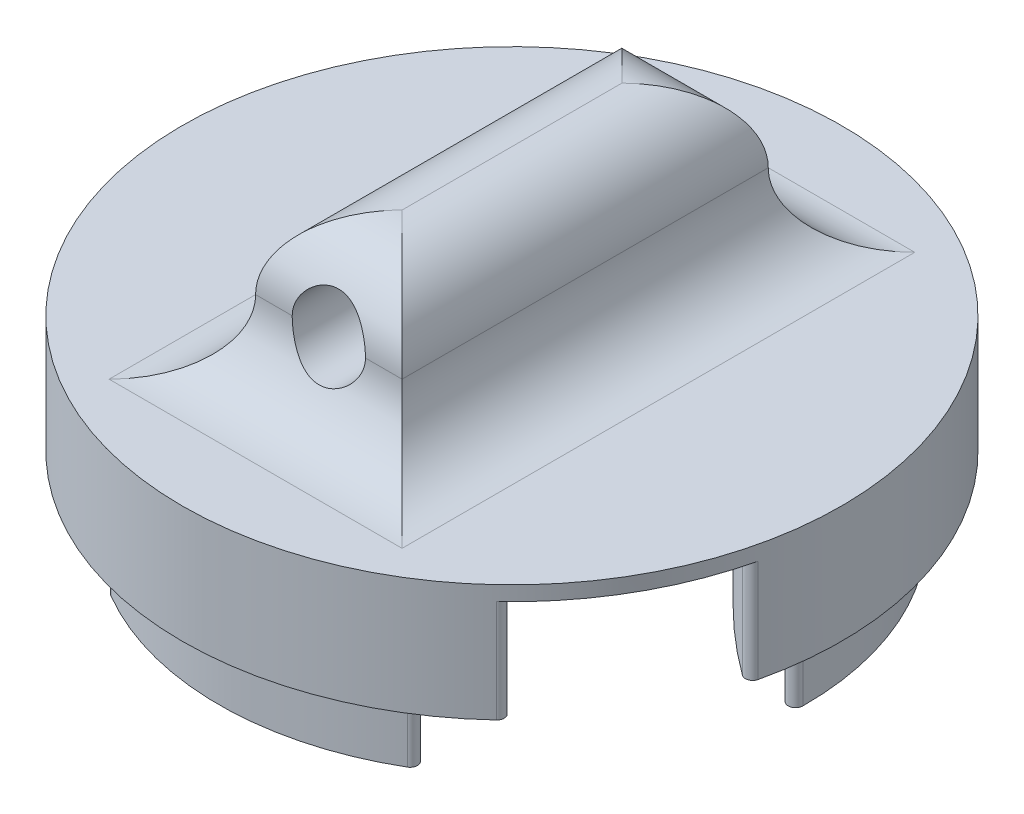
from build123d import *

# Parameters (mm, degrees)
SKETCH1_R                = 37.5
BOSS_EXTRUDE1_DEPTH      = 14
CUT_EXTRUDE2_START       = -14
CUT_EXTRUDE2_DEPTH       = 14
SKETCH4_R                = 45
SKETCH4_R_2              = 37.5
BOSS_EXTRUDE2_DEPTH      = 14
SKETCH6_R                = 45
BOSS_EXTRUDE3_DEPTH      = 2
SKETCH7_R                = 1.75
CUT_EXTRUDE3_DEPTH       = 66.620118866
CIRPATTERN2_COUNT        = 3
BOSS_EXTRUDE4_DEPTH      = 10
FILLET1_R                = 1
CIRPATTERN3_COUNT        = 3
FILLET1_OF_CIRPATTERN3_R = 1
CUT_EXTRUDE4_DEPTH       = 69.01470446
FILLET2_R                = 1
SKETCH15_R               = 45
BOSS_EXTRUDE5_DEPTH      = 2
SKETCH16_W               = 20
SKETCH16_H               = 50
BOSS_EXTRUDE6_DEPTH      = 20
SKETCH17_R               = 5
CUT_EXTRUDE5_DEPTH       = 91.669730467
FILLET3_R                = 10


# Read off the part's stored shape, not the designer's step: Cut-Extrude2
with BuildPart() as part:
    # Sketch1 → Boss-Extrude1 (new body)
    with BuildSketch(Plane(origin=(0, 0, 0), x_dir=(1, 0, 0), z_dir=(0, 1, 0))):
        with Locations(Location((0, 0, 0), (0, 0, 270))):
            Circle(SKETCH1_R)
    extrude(amount=BOSS_EXTRUDE1_DEPTH)

    # Cut-Extrude2 outline → Cut-Extrude2 (cut)
    with BuildSketch(Plane(origin=(0, 14, 0), x_dir=(1, 0, 0), z_dir=(0, 1, 0)).offset(CUT_EXTRUDE2_START)):
        with BuildLine():
            ThreePointArc((-24.104535363, -28.726666617), (0, -24.760936498), (24.104535363, -28.726666617))
            ThreePointArc((24.104535363, -28.726666617), (32.475952642, -18.75), (36.930290738, -6.511806663))
            ThreePointArc((36.930290738, -6.511806663), (21.443600029, 12.380468249), (12.825755375, 35.238473279))
            ThreePointArc((12.825755375, 35.238473279), (0, 37.5), (-12.825755375, 35.238473279))
            ThreePointArc((-12.825755375, 35.238473279), (-21.443600029, 12.380468249), (-36.930290738, -6.511806663))
            ThreePointArc((-36.930290738, -6.511806663), (-32.475952642, -18.75), (-24.104535363, -28.726666617))
        make_face()
    extrude(amount=CUT_EXTRUDE2_DEPTH, mode=Mode.SUBTRACT)

    # Sketch4 → Boss-Extrude2 (add)
    with BuildSketch(Plane(origin=(0, 0, 0), x_dir=(1, 0, 0), z_dir=(0, 1, 0))):
        with Locations(Location((0, 0, 0), (0, 0, 270))):
            Circle(SKETCH4_R)
        Circle(SKETCH4_R_2, mode=Mode.SUBTRACT)
    extrude(amount=BOSS_EXTRUDE2_DEPTH)

    # Sketch6 → Boss-Extrude3 (add)
    with BuildSketch(Plane(origin=(0, 14, 0), x_dir=(1, 0, 0), z_dir=(0, 1, 0))):
        with Locations(Location((0, 0, 0), (0, 0, 270))):
            Circle(SKETCH6_R)
        with BuildLine():
            ThreePointArc((-28.952849653, 1.653026611), (-25.11473671, -14.5), (-13.044861788, -25.900416617))
            ThreePointArc((-13.044861788, -25.900416617), (0, -24.760936498), (13.044861788, -25.900416617))
            ThreePointArc((13.044861788, -25.900416617), (25.11473671, -14.5), (28.952849653, 1.653026611))
            ThreePointArc((28.952849653, 1.653026611), (21.443600029, 12.380468249), (15.907987865, 24.247390006))
            ThreePointArc((15.907987865, 24.247390006), (0, 29), (-15.907987865, 24.247390006))
            ThreePointArc((-15.907987865, 24.247390006), (-21.443600029, 12.380468249), (-28.952849653, 1.653026611))
        make_face(mode=Mode.SUBTRACT)
    extrude(amount=BOSS_EXTRUDE3_DEPTH)

    # Sketch7 → Cut-Extrude3 (cut, through all)
    with BuildSketch(Plane(origin=(0, 16, 0), x_dir=(1, 0, 0), z_dir=(0, 1, 0))):
        with Locations(Location((0, 32, 0), (0, 0, 270))):
            Circle(SKETCH7_R)
    cut_extrude3 = extrude(amount=-CUT_EXTRUDE3_DEPTH, mode=Mode.SUBTRACT)

    # CirPattern2: Cut-Extrude3 ×3 about axis
    cirpattern2_axis = Axis((0, 0, 0), (0, 1, 0))
    for i in range(1, CIRPATTERN2_COUNT):
        add(cut_extrude3.rotate(cirpattern2_axis, i * 360 / CIRPATTERN2_COUNT), mode=Mode.SUBTRACT)

    # Sketch13 → Boss-Extrude4 (add)
    with BuildSketch(Plane.XZ):
        with BuildLine():
            ThreePointArc((-22.11228446, 33.332369792), (0, 29.760936498), (22.11228446, 33.332369792))
            ThreePointArc((22.11228446, 33.332369792), (0, 40), (-22.11228446, 33.332369792))
        make_face()
    boss_extrude4 = extrude(amount=BOSS_EXTRUDE4_DEPTH)

    # Fillet1
    fillet1_edges = [part.edges().sort_by_distance(p)[0] for p in [
        (22.11228446, -5, 33.332369792),
        (-22.11228446, -5, 33.332369792),
    ]]
    fillet(fillet1_edges, radius=FILLET1_R)

    # CirPattern3: Boss-Extrude4 ×3 about axis
    cirpattern3_axis = Axis((0, 0, 0), (0, 1, 0))
    for i in range(1, CIRPATTERN3_COUNT):
        add(boss_extrude4.rotate(cirpattern3_axis, i * 360 / CIRPATTERN3_COUNT))

    # Fillet1 of CirPattern3
    fillet1_of_cirpattern3_edges = [part.edges().sort_by_distance(p)[0] for p in [
        (17.810536778, -5, -35.815984974),
        (39.922821238, -5, 2.483615182),
        (-39.922821238, -5, 2.483615182),
        (-17.810536778, -5, -35.815984974),
    ]]
    fillet(fillet1_of_cirpattern3_edges, radius=FILLET1_OF_CIRPATTERN3_R)

    # Sketch14 → Cut-Extrude4 (cut, through all)
    with BuildSketch(Plane.XZ.offset(-14)):
        with BuildLine():
            Line((-33.206244265, 32.485097805), (-44.736042076, 12.514902195))
            ThreePointArc((-44.736042076, 12.514902195), (-21.443600029, -12.380468249), (-11.529797811, -45))
            Line((-11.529797811, -45), (11.529797811, -45))
            ThreePointArc((11.529797811, -45), (21.443600029, -12.380468249), (44.736042076, 12.514902195))
            Line((44.736042076, 12.514902195), (33.206244265, 32.485097805))
            ThreePointArc((33.206244265, 32.485097805), (0, 24.760936498), (-33.206244265, 32.485097805))
        make_face()
    extrude(amount=CUT_EXTRUDE4_DEPTH, mode=Mode.SUBTRACT)

    # Fillet2
    fillet2_edges = [part.edges().sort_by_distance(p)[0] for p in [
        (43.466885988, 7, 11.646021745),
        (11.64769231, 7, -43.466438362),
        (-31.819193678, 7, 31.820416617),
        (31.819193678, 7, 31.820416617),
        (-11.64769231, 7, -43.466438362),
        (-43.466885988, 7, 11.646021745),
    ]]
    fillet(fillet2_edges, radius=FILLET2_R)

    # Sketch15 → Boss-Extrude5 (add)
    with BuildSketch(Plane.XZ.offset(-14)):
        with Locations(Location((0, 0, 0), (0, 0, 253.108257002))):
            Circle(SKETCH15_R)
    extrude(amount=-BOSS_EXTRUDE5_DEPTH)

    # Sketch16 → Boss-Extrude6 (add)
    with BuildSketch(Plane(origin=(0, 16, 0), x_dir=(1, 0, 0), z_dir=(0, 1, 0))):
        Rectangle(SKETCH16_W, SKETCH16_H)
    extrude(amount=BOSS_EXTRUDE6_DEPTH)

    # Sketch17 → Cut-Extrude5 (cut, through all)
    with BuildSketch(Plane(origin=(0, 0, -25), x_dir=(-1, 0, 0), z_dir=(0, 0, -1))):
        with Locations((0, 26)):
            Circle(SKETCH17_R)
    extrude(amount=-CUT_EXTRUDE5_DEPTH, mode=Mode.SUBTRACT)

    # Fillet3
    # the kernel refuses this fillet: 10 mm, written as the material it adds along each edge
    with BuildSketch(Plane(origin=(-10, 16, -25), x_dir=(0, 0, -1), z_dir=(1, 0, 0))) as fillet3_piece_1_section:
        with BuildLine():
            CenterArc((FILLET3_R, FILLET3_R), FILLET3_R, 180, 90)
            Line((0, FILLET3_R), (0, 0))
            Line((0, 0), (FILLET3_R, 0))
        make_face()
    fillet3_piece_1 = extrude(amount=20, mode=Mode.PRIVATE)
    fillet3_piece_1 = fillet3_piece_1 - Plane(origin=(0, 26, -27.35205283), x_dir=(-1, 0, 0), z_dir=(0, 0, -1)) * Cylinder(5, 80, mode=Mode.PRIVATE)
    add(fillet3_piece_1)
    with BuildSketch(Plane(origin=(10, 16, 25), x_dir=(0, 0, 1), z_dir=(-1, 0, 0))) as fillet3_piece_2_section:
        with BuildLine():
            CenterArc((FILLET3_R, FILLET3_R), FILLET3_R, 180, 90)
            Line((0, FILLET3_R), (0, 0))
            Line((0, 0), (FILLET3_R, 0))
        make_face()
    fillet3_piece_2 = extrude(amount=20, mode=Mode.PRIVATE)
    fillet3_piece_2 = fillet3_piece_2 - Plane(origin=(0, 26, 27.35205283), x_dir=(-1, 0, 0), z_dir=(0, 0, -1)) * Cylinder(5, 80, mode=Mode.PRIVATE)
    add(fillet3_piece_2)
    with BuildSketch(Plane(origin=(10, 16, -25), x_dir=(1, 0, 0), z_dir=(0, 0, 1)), Plane(origin=(-10, 16, 25), x_dir=(-1, 0, 0), z_dir=(0, 0, -1))) as fillet3_piece_3:
        with BuildLine():
            CenterArc((FILLET3_R, FILLET3_R), FILLET3_R, 180, 90)
            Line((0, FILLET3_R), (0, 0))
            Line((0, 0), (FILLET3_R, 0))
        make_face()
    extrude(amount=50)
    with BuildSketch(Plane(origin=(-35, 16, -25), x_dir=(0, 0, -1), z_dir=(1, 0, 0))) as fillet3_piece_4a_section:
        with BuildLine():
            CenterArc((FILLET3_R, FILLET3_R), FILLET3_R, 180, 90)
            Line((0, FILLET3_R), (0, 0))
            Line((0, 0), (FILLET3_R, 0))
        make_face()
    fillet3_piece_4a = extrude(amount=45, mode=Mode.PRIVATE)
    fillet3_piece_4a = fillet3_piece_4a & Plane(origin=(0, 18.302066934, 0), x_dir=(0, 0, 1), z_dir=(0, -1, 0)) * Cylinder(45, 130, mode=Mode.PRIVATE)
    fillet3_piece_4a = split(fillet3_piece_4a, bisect_by=Plane(origin=(-10, 18.302066934, -27.180095081), z_dir=(-1, 0, 0)), keep=Keep.TOP, mode=Mode.PRIVATE)
    with BuildSketch(Plane(origin=(-10, 16, 25), x_dir=(-1, 0, 0), z_dir=(0, 0, -1))) as fillet3_piece_4b_section:
        with BuildLine():
            CenterArc((FILLET3_R, FILLET3_R), FILLET3_R, 180, 90)
            Line((0, FILLET3_R), (0, 0))
            Line((0, 0), (FILLET3_R, 0))
        make_face()
    fillet3_piece_4b = extrude(amount=75, mode=Mode.PRIVATE)
    fillet3_piece_4b = fillet3_piece_4b & Plane(origin=(0, 18.30933206, 0), x_dir=(0, 0, 1), z_dir=(0, -1, 0)) * Cylinder(45, 190, mode=Mode.PRIVATE)
    fillet3_piece_4b = split(fillet3_piece_4b, bisect_by=Plane(origin=(-12.183620905, 18.30933206, -25), z_dir=(0, 0, -1)), keep=Keep.TOP, mode=Mode.PRIVATE)
    fillet3_piece_4 = fillet3_piece_4a & fillet3_piece_4b
    add(fillet3_piece_4)
    with BuildSketch(Plane(origin=(10, 16, -50), x_dir=(1, 0, 0), z_dir=(0, 0, 1))) as fillet3_piece_5a_section:
        with BuildLine():
            CenterArc((FILLET3_R, FILLET3_R), FILLET3_R, 180, 90)
            Line((0, FILLET3_R), (0, 0))
            Line((0, 0), (FILLET3_R, 0))
        make_face()
    fillet3_piece_5a = extrude(amount=75, mode=Mode.PRIVATE)
    fillet3_piece_5a = fillet3_piece_5a & Plane(origin=(0, 18.309328242, 0), x_dir=(0, 0, 1), z_dir=(0, -1, 0)) * Cylinder(45, 190, mode=Mode.PRIVATE)
    fillet3_piece_5a = split(fillet3_piece_5a, bisect_by=Plane(origin=(12.1836193, 18.309328242, -25), z_dir=(0, 0, -1)), keep=Keep.TOP, mode=Mode.PRIVATE)
    with BuildSketch(Plane(origin=(-10, 16, -25), x_dir=(0, 0, -1), z_dir=(1, 0, 0))) as fillet3_piece_5b_section:
        with BuildLine():
            CenterArc((FILLET3_R, FILLET3_R), FILLET3_R, 180, 90)
            Line((0, FILLET3_R), (0, 0))
            Line((0, 0), (FILLET3_R, 0))
        make_face()
    fillet3_piece_5b = extrude(amount=45, mode=Mode.PRIVATE)
    fillet3_piece_5b = fillet3_piece_5b & Plane(origin=(0, 18.30206696, 0), x_dir=(0, 0, 1), z_dir=(0, -1, 0)) * Cylinder(45, 130, mode=Mode.PRIVATE)
    fillet3_piece_5b = split(fillet3_piece_5b, bisect_by=Plane(origin=(10, 18.30206696, -27.180094929), z_dir=(1, 0, 0)), keep=Keep.TOP, mode=Mode.PRIVATE)
    fillet3_piece_5 = fillet3_piece_5a & fillet3_piece_5b
    add(fillet3_piece_5)
    with BuildSketch(Plane(origin=(10, 16, -25), x_dir=(1, 0, 0), z_dir=(0, 0, 1))) as fillet3_piece_6a_section:
        with BuildLine():
            CenterArc((FILLET3_R, FILLET3_R), FILLET3_R, 180, 90)
            Line((0, FILLET3_R), (0, 0))
            Line((0, 0), (FILLET3_R, 0))
        make_face()
    fillet3_piece_6a = extrude(amount=75, mode=Mode.PRIVATE)
    fillet3_piece_6a = fillet3_piece_6a & Plane(origin=(0, 18.30933206, 0), x_dir=(0, 0, 1), z_dir=(0, -1, 0)) * Cylinder(45, 190, mode=Mode.PRIVATE)
    fillet3_piece_6a = split(fillet3_piece_6a, bisect_by=Plane(origin=(12.183620905, 18.30933206, 25), z_dir=(0, 0, 1)), keep=Keep.TOP, mode=Mode.PRIVATE)
    with BuildSketch(Plane(origin=(35, 16, 25), x_dir=(0, 0, 1), z_dir=(-1, 0, 0))) as fillet3_piece_6b_section:
        with BuildLine():
            CenterArc((FILLET3_R, FILLET3_R), FILLET3_R, 180, 90)
            Line((0, FILLET3_R), (0, 0))
            Line((0, 0), (FILLET3_R, 0))
        make_face()
    fillet3_piece_6b = extrude(amount=45, mode=Mode.PRIVATE)
    fillet3_piece_6b = fillet3_piece_6b & Plane(origin=(0, 18.302066934, 0), x_dir=(0, 0, 1), z_dir=(0, -1, 0)) * Cylinder(45, 130, mode=Mode.PRIVATE)
    fillet3_piece_6b = split(fillet3_piece_6b, bisect_by=Plane(origin=(10, 18.302066934, 27.180095081), z_dir=(1, 0, 0)), keep=Keep.TOP, mode=Mode.PRIVATE)
    fillet3_piece_6 = fillet3_piece_6a & fillet3_piece_6b
    add(fillet3_piece_6)
    with BuildSketch(Plane(origin=(-10, 16, 50), x_dir=(-1, 0, 0), z_dir=(0, 0, -1))) as fillet3_piece_7a_section:
        with BuildLine():
            CenterArc((FILLET3_R, FILLET3_R), FILLET3_R, 180, 90)
            Line((0, FILLET3_R), (0, 0))
            Line((0, 0), (FILLET3_R, 0))
        make_face()
    fillet3_piece_7a = extrude(amount=75, mode=Mode.PRIVATE)
    fillet3_piece_7a = fillet3_piece_7a & Plane(origin=(0, 18.309328242, 0), x_dir=(0, 0, 1), z_dir=(0, -1, 0)) * Cylinder(45, 190, mode=Mode.PRIVATE)
    fillet3_piece_7a = split(fillet3_piece_7a, bisect_by=Plane(origin=(-12.1836193, 18.309328242, 25), z_dir=(0, 0, 1)), keep=Keep.TOP, mode=Mode.PRIVATE)
    with BuildSketch(Plane(origin=(10, 16, 25), x_dir=(0, 0, 1), z_dir=(-1, 0, 0))) as fillet3_piece_7b_section:
        with BuildLine():
            CenterArc((FILLET3_R, FILLET3_R), FILLET3_R, 180, 90)
            Line((0, FILLET3_R), (0, 0))
            Line((0, 0), (FILLET3_R, 0))
        make_face()
    fillet3_piece_7b = extrude(amount=45, mode=Mode.PRIVATE)
    fillet3_piece_7b = fillet3_piece_7b & Plane(origin=(0, 18.302066961, 0), x_dir=(0, 0, 1), z_dir=(0, -1, 0)) * Cylinder(45, 130, mode=Mode.PRIVATE)
    fillet3_piece_7b = split(fillet3_piece_7b, bisect_by=Plane(origin=(-10, 18.302066961, 27.180094929), z_dir=(-1, 0, 0)), keep=Keep.TOP, mode=Mode.PRIVATE)
    fillet3_piece_7 = fillet3_piece_7a & fillet3_piece_7b
    add(fillet3_piece_7)
    # the kernel refuses this fillet: 10 mm, written as the material it takes off along each edge
    with BuildSketch(Plane(origin=(-35, 36, -25), x_dir=(0, 0, 1), z_dir=(1, 0, 0))) as fillet3_2_piece_1:
        with BuildLine():
            CenterArc((FILLET3_R, FILLET3_R), FILLET3_R, 180, 90)
            Line((0, FILLET3_R), (0, 0))
            Line((0, 0), (FILLET3_R, 0))
        make_face()
    extrude(amount=70, mode=Mode.SUBTRACT)
    with BuildSketch(Plane(origin=(35, 36, 25), x_dir=(0, -1, 0), z_dir=(-1, 0, 0))) as fillet3_2_piece_2:
        with BuildLine():
            CenterArc((FILLET3_R, -FILLET3_R), FILLET3_R, 90, 90)
            Line((0, -FILLET3_R), (0, 0))
            Line((0, 0), (FILLET3_R, 0))
        make_face()
    extrude(amount=70, mode=Mode.SUBTRACT)
    with BuildSketch(Plane(origin=(10, 36, -50), x_dir=(0, -1, 0), z_dir=(0, 0, 1)), Plane(origin=(-10, 36, 50), x_dir=(0, -1, 0), z_dir=(0, 0, -1))) as fillet3_2_piece_3:
        with BuildLine():
            CenterArc((FILLET3_R, -FILLET3_R), FILLET3_R, 90, 90)
            Line((0, -FILLET3_R), (0, 0))
            Line((0, 0), (FILLET3_R, 0))
        make_face()
    extrude(amount=100, mode=Mode.SUBTRACT)


solid = part.part
